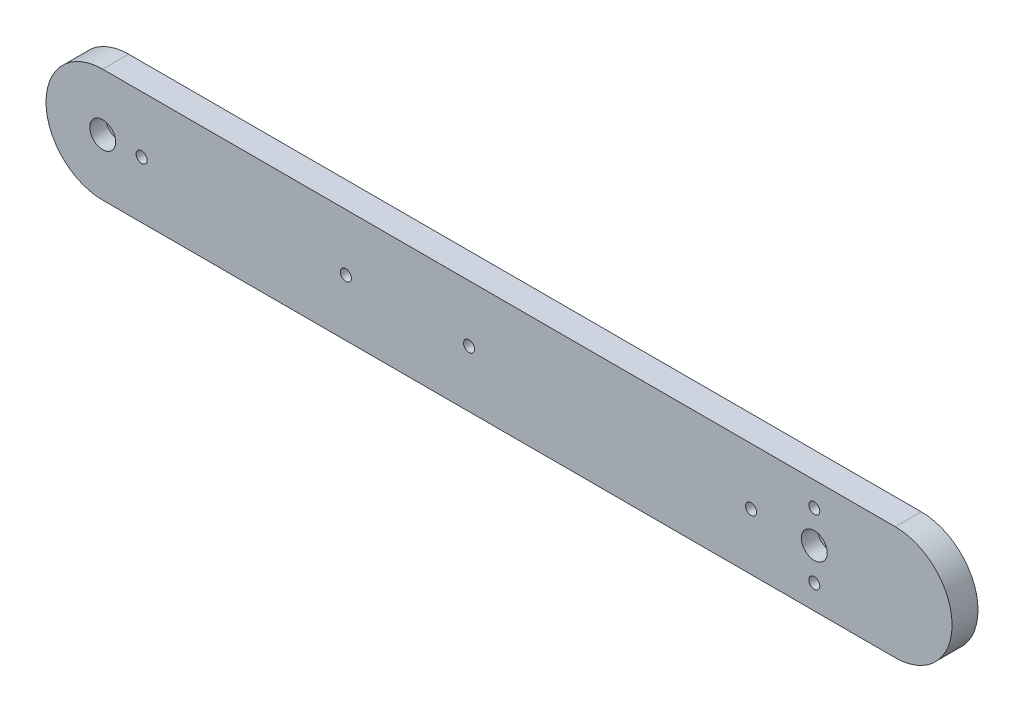
from build123d import *

# Parameters (mm, degrees)
CUT_EXTRUDE1_START         = -8.000000119
CUT_EXTRUDE1_OUTLINE_R     = 3.999999708
CUT_EXTRUDE1_OUTLINE_R_2   = 4
CUT_EXTRUDE1_OUTLINE_R_3   = 4.000000498
CUT_EXTRUDE1_OUTLINE_R_4   = 1.7
CUT_EXTRUDE1_DEPTH         = 8.000000119
CUT_EXTRUDE1_2_OUTLINE_R   = 4
CUT_EXTRUDE1_2_OUTLINE_R_2 = 1.7
CUT_EXTRUDE1_2_DEPTH       = 4.000000119
CUT_EXTRUDE1_START_2       = -3.000000119
CUT_EXTRUDE1_3_OUTLINE_R   = 4.000000498
CUT_EXTRUDE1_3_OUTLINE_R_2 = 1.699999454
CUT_EXTRUDE1_3_OUTLINE_R_3 = 3.999999708
CUT_EXTRUDE1_3_OUTLINE_R_4 = 1.700000883
CUT_EXTRUDE1_3_DEPTH       = 3.000000119
SKETCH2_R                  = 1.7
CUT_EXTRUDE2_DEPTH         = 133.217863668
BOSS_EXTRUDE1_START        = -8.000000119
BOSS_EXTRUDE1_DEPTH        = 8.000000119
SKETCH4_R                  = 4
SKETCH4_R_2                = 1.7
CUT_EXTRUDE3_DEPTH         = 4
SKETCH5_R                  = 1.7
CUT_EXTRUDE4_DEPTH         = 157.425904707


with BuildPart() as part:
    # Cut-Extrude1: read off the stored shape, not the designer's step
    # Cut-Extrude1 outline → Cut-Extrude1 (new body)
    # profile 1 of 3: a face of its own
    with BuildSketch(Plane(origin=(0, 0, 0), x_dir=(-1, 0, 0), z_dir=(0, 0, -1)).offset(CUT_EXTRUDE1_START)):
        with BuildLine():
            ThreePointArc((109.750003815, 0), (127.250003815, 17.5), (109.750003815, 35))
            Line((109.750003815, 35), (-109.750003815, 35))
            ThreePointArc((-109.750003815, 35), (-127.250003815, 17.5), (-109.750003815, 0))
            Line((-109.750003815, 0), (109.750003815, 0))
        make_face()
        with Locations((-109.750001685, 17.500000345)):
            Circle(CUT_EXTRUDE1_OUTLINE_R, mode=Mode.SUBTRACT)
        with Locations((-90.249998482, 17.5)):
            Circle(CUT_EXTRUDE1_OUTLINE_R_2, mode=Mode.SUBTRACT)
        with Locations((-3.249998482, 17.5)):
            Circle(CUT_EXTRUDE1_OUTLINE_R_2, mode=Mode.SUBTRACT)
        with Locations((34.750001518, 17.5)):
            Circle(CUT_EXTRUDE1_OUTLINE_R_2, mode=Mode.SUBTRACT)
        with Locations((97.750001518, 17.5)):
            Circle(CUT_EXTRUDE1_OUTLINE_R_2, mode=Mode.SUBTRACT)
        with Locations((109.750001518, 17.500000345)):
            Circle(CUT_EXTRUDE1_OUTLINE_R_3, mode=Mode.SUBTRACT)
    # profile 2 of 3: a face of its own
    with BuildSketch(Plane(origin=(0, 0, 0), x_dir=(-1, 0, 0), z_dir=(0, 0, -1)).offset(CUT_EXTRUDE1_START)):
        with Locations((-3.249998482, 17.5)):
            Circle(CUT_EXTRUDE1_OUTLINE_R_4)
    # profile 3 of 3: a face of its own
    with BuildSketch(Plane(origin=(0, 0, 0), x_dir=(-1, 0, 0), z_dir=(0, 0, -1)).offset(CUT_EXTRUDE1_START)):
        with Locations((-90.249998482, 17.5)):
            Circle(CUT_EXTRUDE1_OUTLINE_R_4)
    extrude(amount=CUT_EXTRUDE1_DEPTH)

    # Cut-Extrude1 2 outline → Cut-Extrude1 2 (add)
    # profile 1 of 4: a face of its own
    with BuildSketch(Plane(origin=(0, 0, 0), x_dir=(-1, 0, 0), z_dir=(0, 0, -1)).offset(CUT_EXTRUDE1_START)):
        with Locations((34.750001518, 17.5)):
            Circle(CUT_EXTRUDE1_2_OUTLINE_R)
        with Locations((34.750001518, 17.5)):
            Circle(CUT_EXTRUDE1_2_OUTLINE_R_2, mode=Mode.SUBTRACT)
    # profile 2 of 4: a face of its own
    with BuildSketch(Plane(origin=(0, 0, 0), x_dir=(-1, 0, 0), z_dir=(0, 0, -1)).offset(CUT_EXTRUDE1_START)):
        with Locations((97.750001518, 17.5)):
            Circle(CUT_EXTRUDE1_2_OUTLINE_R)
        with Locations((97.750001518, 17.5)):
            Circle(CUT_EXTRUDE1_2_OUTLINE_R_2, mode=Mode.SUBTRACT)
    # profile 3 of 4: a face of its own
    with BuildSketch(Plane(origin=(0, 0, 0), x_dir=(-1, 0, 0), z_dir=(0, 0, -1)).offset(CUT_EXTRUDE1_START)):
        with Locations((-3.249998482, 17.5)):
            Circle(CUT_EXTRUDE1_2_OUTLINE_R)
        with Locations((-3.249998482, 17.5)):
            Circle(CUT_EXTRUDE1_2_OUTLINE_R_2, mode=Mode.SUBTRACT)
    # profile 4 of 4: a face of its own
    with BuildSketch(Plane(origin=(0, 0, 0), x_dir=(-1, 0, 0), z_dir=(0, 0, -1)).offset(CUT_EXTRUDE1_START)):
        with Locations((-90.249998482, 17.5)):
            Circle(CUT_EXTRUDE1_2_OUTLINE_R)
        with Locations((-90.249998482, 17.5)):
            Circle(CUT_EXTRUDE1_2_OUTLINE_R_2, mode=Mode.SUBTRACT)
    extrude(amount=CUT_EXTRUDE1_2_DEPTH)

    # Cut-Extrude1 3 outline → Cut-Extrude1 3 (add)
    # profile 1 of 2: a face of its own
    with BuildSketch(Plane(origin=(0, 0, 0), x_dir=(-1, 0, 0), z_dir=(0, 0, -1)).offset(CUT_EXTRUDE1_START_2)):
        with Locations((109.750001518, 17.500000345)):
            Circle(CUT_EXTRUDE1_3_OUTLINE_R)
        with Locations((109.750002847, 17.500000345)):
            Circle(CUT_EXTRUDE1_3_OUTLINE_R_2, mode=Mode.SUBTRACT)
    # profile 2 of 2: a face of its own
    with BuildSketch(Plane(origin=(0, 0, 0), x_dir=(-1, 0, 0), z_dir=(0, 0, -1)).offset(CUT_EXTRUDE1_START_2)):
        with Locations((-109.750001685, 17.500000345)):
            Circle(CUT_EXTRUDE1_3_OUTLINE_R_3)
        with Locations((-109.750001213, 17.500000345)):
            Circle(CUT_EXTRUDE1_3_OUTLINE_R_4, mode=Mode.SUBTRACT)
    extrude(amount=CUT_EXTRUDE1_3_DEPTH)

    # Sketch2 → Cut-Extrude2 (cut, through all)
    with BuildSketch(Plane(origin=(0, 0, 0), x_dir=(-1, 0, 0), z_dir=(0, 0, -1))):
        with Locations((-90.249998482, 17.5)):
            Circle(SKETCH2_R)
        with Locations((-3.249998482, 17.5)):
            Circle(SKETCH2_R)
    extrude(amount=-CUT_EXTRUDE2_DEPTH, mode=Mode.SUBTRACT)

    # Sketch3 → Boss-Extrude1 (add)
    with BuildSketch(Plane(origin=(0, 0, 0), x_dir=(-1, 0, 0), z_dir=(0, 0, -1)).offset(BOSS_EXTRUDE1_START)):
        with BuildLine():
            Line((-109.750003815, 35), (-134.750003815, 35))
            ThreePointArc((-134.750003815, 35), (-152.250003815, 17.5), (-134.750003815, 0))
            Line((-134.750003815, 0), (-109.750003815, 0))
            ThreePointArc((-109.750003815, 0), (-127.250003815, 17.5), (-109.750003815, 35))
        make_face()
    extrude(amount=BOSS_EXTRUDE1_DEPTH)

    # Sketch4 → Cut-Extrude3 (cut)
    # profile 1 of 2: a face of its own
    with BuildSketch(Plane(origin=(0, 0, 0), x_dir=(-1, 0, 0), z_dir=(0, 0, -1))):
        with Locations((-109.750001213, 27.500000345)):
            Circle(SKETCH4_R)
        with Locations((-109.750001213, 27.500000345)):
            Circle(SKETCH4_R_2, mode=Mode.SUBTRACT)
    # profile 2 of 2: a face of its own
    with BuildSketch(Plane(origin=(0, 0, 0), x_dir=(-1, 0, 0), z_dir=(0, 0, -1))):
        with Locations(Location((-109.750001213, 7.500000345, 0), (0, 0, 180))):
            Circle(SKETCH4_R)
        with Locations(Location((-109.750001213, 7.500000345, 0), (0, 0, 180))):
            Circle(SKETCH4_R_2, mode=Mode.SUBTRACT)
    extrude(amount=-CUT_EXTRUDE3_DEPTH, mode=Mode.SUBTRACT)

    # Sketch5 → Cut-Extrude4 (cut, through all)
    with BuildSketch(Plane(origin=(0, 0, 0), x_dir=(-1, 0, 0), z_dir=(0, 0, -1))):
        with Locations((-109.750001213, 27.500000345)):
            Circle(SKETCH5_R)
        with Locations((-109.750001213, 7.500000345)):
            Circle(SKETCH5_R)
    extrude(amount=-CUT_EXTRUDE4_DEPTH, mode=Mode.SUBTRACT)


solid = part.part
